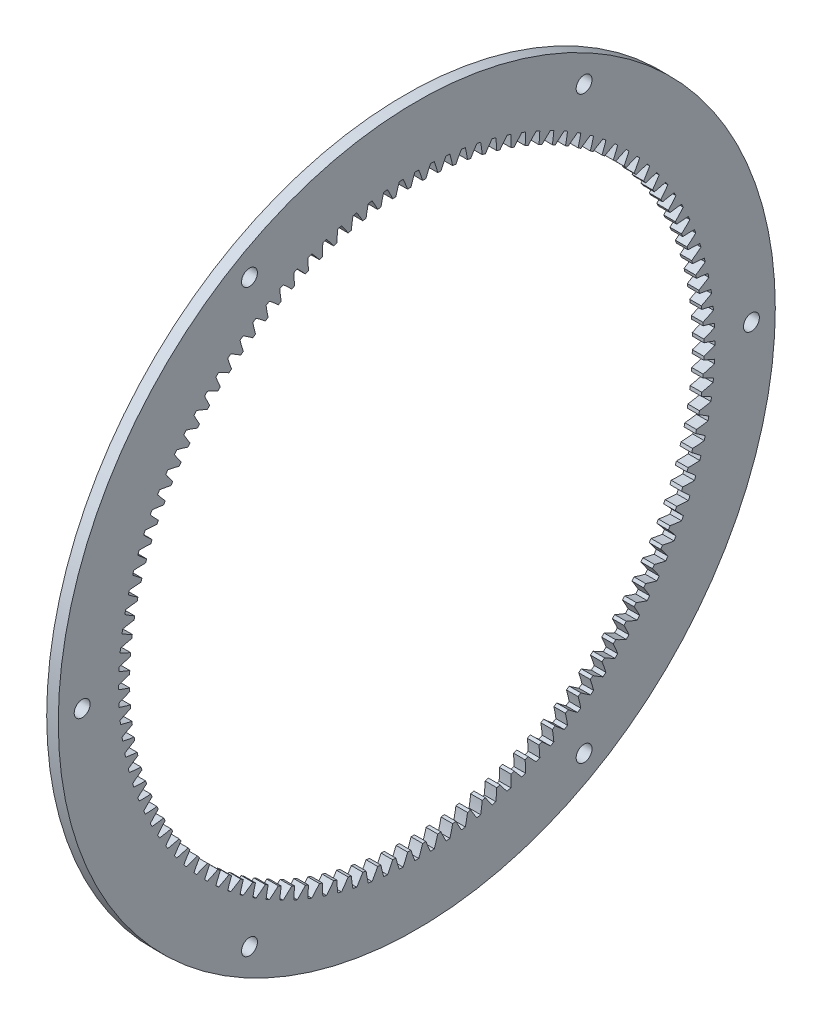
from build123d import *

# Parameters (mm, degrees)
BASPROSKE_W        = 4.7625
BASPROSKE_H        = 29.32
TOOTHCUT_DEPTH     = 209.396368026
TEETHCUTS_COUNT    = 120
TEETHCUTS_ANGLE    = 357
SKETCH1_R          = 3.2639
CUT_EXTRUDE1_DEPTH = 209.396368026


with BuildPart() as part:
    # BasProSke → Base-Revolve (revolve)
    with BuildSketch(Plane(origin=(0, 0, 0), x_dir=(1, 0, 0), z_dir=(0, 1, 0))):
        with Locations((2.38125, 132.66)):
            Rectangle(BASPROSKE_W, BASPROSKE_H)
    revolve(axis=Axis((-10, 0, 0), (1, 0, 0)))

    # TooCutSke → ToothCut (cut, through all)
    with BuildSketch(Plane(origin=(0, 0, 0), x_dir=(0, 0, -1), z_dir=(1, 0, 0))):
        with BuildLine():
            ThreePointArc((2.41396766, 117.949900404), (1.648624524, 120.240498651), (0.791720585, 122.498441539))
            ThreePointArc((0.791720585, 122.498441539), (0, 122.501), (-0.791720585, 122.498441539))
            ThreePointArc((-0.791720585, 122.498441539), (-1.648624524, 120.240498651), (-2.41396766, 117.949900404))
            ThreePointArc((-2.41396766, 117.949900404), (0, 117.9746), (2.41396766, 117.949900404))
        make_face()
    toothcut = extrude(amount=TOOTHCUT_DEPTH, mode=Mode.SUBTRACT)

    # TeethCuts: ToothCut ×120 about axis
    teethcuts_axis = Axis((-10, 0, 0), (1, 0, 0))
    for i in range(1, TEETHCUTS_COUNT):
        add(toothcut.rotate(teethcuts_axis, i * TEETHCUTS_ANGLE / (TEETHCUTS_COUNT - 1)), mode=Mode.SUBTRACT)

    # Sketch1 → Cut-Extrude1 (cut, through all)
    with BuildSketch(Plane(origin=(4.7625, 0, 0), x_dir=(0, 0, -1), z_dir=(1, 0, 0))):
        with Locations((-68.750000014, 119.078493045)):
            Circle(SKETCH1_R)
        with Locations((68.750000014, 119.078493045)):
            Circle(SKETCH1_R)
        with Locations((137.500000028, 0)):
            Circle(SKETCH1_R)
        with Locations((68.750000014, -119.078493045)):
            Circle(SKETCH1_R)
        with Locations((-68.750000014, -119.078493045)):
            Circle(SKETCH1_R)
        with Locations((-137.500000028, 0)):
            Circle(SKETCH1_R)
    extrude(amount=-CUT_EXTRUDE1_DEPTH, mode=Mode.SUBTRACT)


solid = part.part
